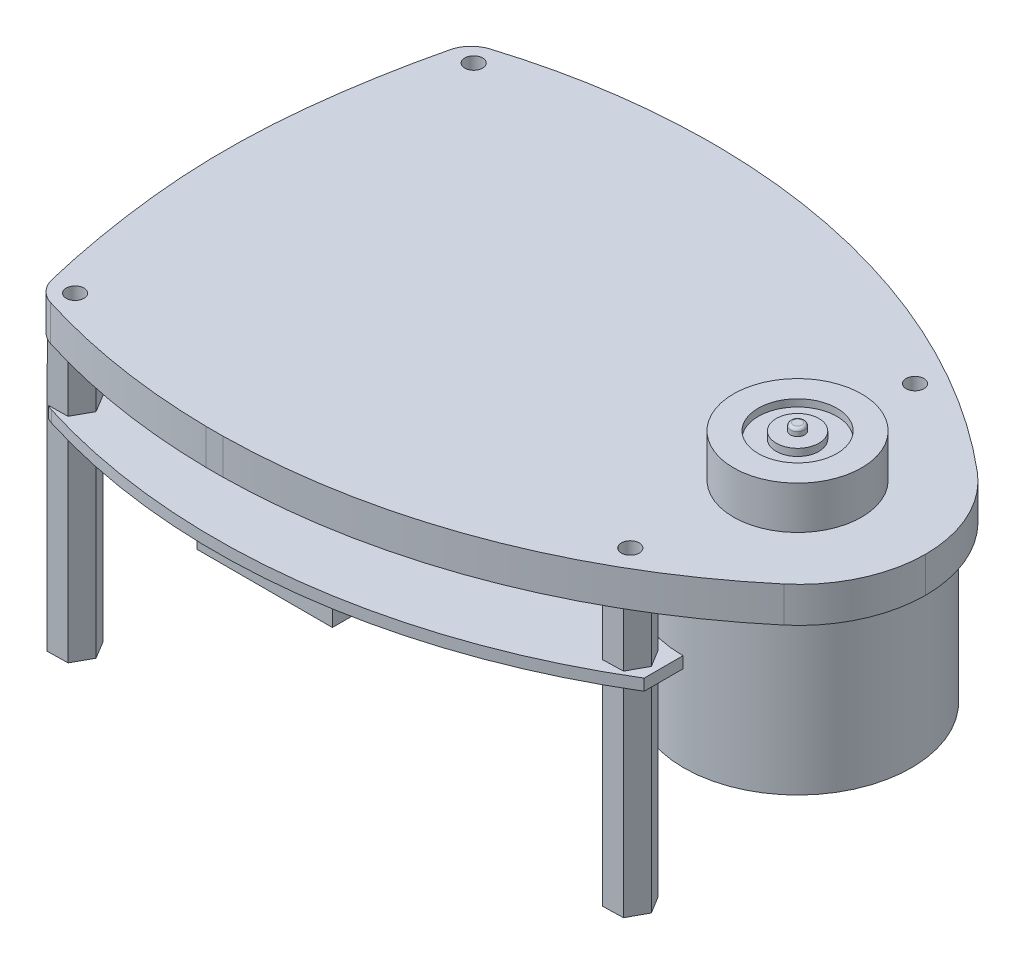
from build123d import *

# Parameters (mm, degrees)
SKETCH_1_W          = 98.5
SKETCH_1_H          = 70
EXTRUDE_1_DEPTH     = 5
SKETCH_2_R          = 35
EXTRUDE_2_DEPTH     = 28.1
SKETCH_3_R          = 2
CUT_EXTRUDE_1_DEPTH = 5
FILLET_1_R          = 2
FILLET_2_R          = 1
SKETCH_4_R          = 13
SKETCH_4_W          = 3.316540618
SKETCH_4_H          = 5.120069114
SKETCH_4_W_2        = 3.276095001
SKETCH_4_W_3        = 1.001370982
SKETCH_4_H_2        = 2.121481923
SKETCH_4_H_3        = 2.893302243
SKETCH_4_W_4        = 1.096399653
SKETCH_4_H_4        = 2.99297568
SKETCH_4_W_5        = 1.536933457
SKETCH_4_H_5        = 3.356986235
SKETCH_4_W_6        = 1.658270309
SKETCH_4_W_7        = 1.334705371
SKETCH_4_H_6        = 1.05158605
SKETCH_4_W_8        = 1.294259754
SKETCH_4_H_7        = 1.092031667
CUT_EXTRUDE_3_DEPTH = 0.5
SKETCH_5_R          = 1.25
CUT_EXTRUDE_4_DEPTH = 5
SKETCH_6_R          = 9
EXTRUDE_3_DEPTH     = 7
CUT_EXTRUDE_START   = -1
SKETCH_7_R          = 9
SKETCH_7_R_2        = 0.99350654
CUT_EXTRUDE_5_DEPTH = 1
SKETCH_8_R          = 5.521677929
SKETCH_8_R_2        = 3.001097475
CUT_EXTRUDE_6_DEPTH = 1
FILLET_3_R          = 0.4
SKETCH_9_R          = 16
EXTRUDE_4_DEPTH     = 27
EXTRUDE_5_DEPTH     = 38
SKETCH_11_R         = 26
EXTRUDE_6_DEPTH     = 8
FILLET_4_R          = 1
SKETCH_12_W         = 106.251501727
SKETCH_12_H         = 75.565901032
CUT_EXTRUDE_7_DEPTH = 8
FILLET_5_R          = 100
EXTRUDE_START       = 8
EXTRUDE_7_DEPTH     = 1.6
SKETCH_14_W         = 20
SKETCH_14_H         = 5
EXTRUDE_8_DEPTH     = 6
CHAMFER_1_SIZE      = 1
CUT_EXTRUDE1_START  = -28.1
SKETCH1_R           = 35
CUT_EXTRUDE1_DEPTH  = 28.1


with BuildPart() as part:
    # Эскиз1 → Бобышка-Вытянуть1 (new body)
    with BuildSketch(Plane(origin=(0, 0, 0), x_dir=(1, 0, 0), z_dir=(0, 1, 0))):
        Rectangle(SKETCH_1_W, SKETCH_1_H)
    extrude(amount=EXTRUDE_1_DEPTH)

    # Эскиз2 → Бобышка-Вытянуть2 (add)
    with BuildSketch(Plane(origin=(0, 5, 0), x_dir=(1, 0, 0), z_dir=(0, 1, 0))):
        with Locations(Location((-14.25, 0, 0), (0, 0, 270))):
            Circle(SKETCH_2_R)
    extrude(amount=EXTRUDE_2_DEPTH)

    # Эскиз3 → Вырез-Вытянуть1 (cut)
    with BuildSketch(Plane(origin=(0, 33.1, 0), x_dir=(1, 0, 0), z_dir=(0, 1, 0))):
        with Locations(Location((-14.25, 28.5, 0), (0, 0, 270))):
            Circle(SKETCH_3_R)
        with Locations(Location((-34.553940504, -20, 0), (0, 0, 270))):
            Circle(SKETCH_3_R)
        with Locations(Location((6.053940504, -20, 0), (0, 0, 270))):
            Circle(SKETCH_3_R)
    extrude(amount=-CUT_EXTRUDE_1_DEPTH, mode=Mode.SUBTRACT)

    # Скругление1
    fillet_1_edges = [part.edges().sort_by_distance(p)[0] for p in [
        (-14.25, 33.1, -35),
    ]]
    fillet(fillet_1_edges, radius=FILLET_1_R)

    # Скругление2
    fillet_2_edges = [part.edges().sort_by_distance(p)[0] for p in [
        (-14.25, 33.1, -30.5),
        (-34.553940504, 33.1, 18),
        (6.053940504, 33.1, 18),
    ]]
    fillet(fillet_2_edges, radius=FILLET_2_R)

    # Эскиз4 → Вырез-Вытянуть3 (cut)
    # profile 1 of 7: a face of its own
    with BuildSketch(Plane(origin=(0, 33.1, 0), x_dir=(1, 0, 0), z_dir=(0, 1, 0))):
        with Locations(Location((-14.25, 0, 0), (0, 0, 270))):
            Circle(SKETCH_4_R)
        Polygon((-22.115166942, -6.914876839), (-22.115166942, -0.831627154), (-19.0735421, -0.831627154), (-19.0735421, -5.853844917), (-21.266341405, -5.853844917), (-21.266341405, -6.914876839), align=None, mode=Mode.SUBTRACT)
        Polygon((-22.115166942, 0), (-22.115166942, 5.120069114), (-19.0735421, 5.120069114), (-19.0735421, 4.27071115), (-21.266341405, 4.27071115), (-21.266341405, 0), align=None, mode=Mode.SUBTRACT)
        Polygon((-13.829606569, 0), (-13.829606569, 6.292992015), (-12.980248606, 6.292992015), (-12.980248606, 5.120069114), (-10.715294037, 5.120069114), (-10.715294037, 0), align=None, mode=Mode.SUBTRACT)
        with Locations((-16.458571693, 2.560034557)):
            Rectangle(SKETCH_4_W, SKETCH_4_H, mode=Mode.SUBTRACT)
        with Locations((-8.187442955, 2.560034557)):
            Rectangle(SKETCH_4_W_2, SKETCH_4_H, mode=Mode.SUBTRACT)
        with Locations((-7.050080946, -1.825090787)):
            Rectangle(SKETCH_4_W_3, SKETCH_4_H_2, mode=Mode.SUBTRACT)
        with Locations((-7.050080946, -5.468225718)):
            Rectangle(SKETCH_4_W_3, SKETCH_4_H_3, mode=Mode.SUBTRACT)
        Polygon((-9.825490456, -0.831627154), (-8.643651064, -0.831627154), (-8.643651064, -2.960833634), (-7.550766437, -2.960833634), (-7.550766437, -3.957287265), (-8.643651064, -3.957287265), (-8.643651064, -5.853844917), (-9.825490456, -5.853844917), align=None, mode=Mode.SUBTRACT)
        Polygon((-13.829606569, -0.831627154), (-10.715294037, -0.831627154), (-10.715294037, -5.853844917), (-13.829606569, -5.853844917), (-13.829606569, -3.04994558), (-11.645543235, -3.04994558), (-11.645543235, -1.940786367), (-13.829606569, -1.940786367), align=None, mode=Mode.SUBTRACT)
        Polygon((-18.116842002, -0.831627154), (-14.800301384, -0.831627154), (-14.800301384, -4.141977247), (-16.943919101, -4.141977247), (-16.943919101, -4.950889593), (-14.800301384, -4.950889593), (-14.800301384, -5.853844917), (-18.116842002, -5.853844917), align=None, mode=Mode.SUBTRACT)
    # profile 2 of 7: a face of its own
    with BuildSketch(Plane(origin=(0, 33.1, 0), x_dir=(1, 0, 0), z_dir=(0, 1, 0))):
        with Locations((-20.718141579, -3.454401753)):
            Rectangle(SKETCH_4_W_4, SKETCH_4_H_4)
    # profile 3 of 7: a face of its own
    with BuildSketch(Plane(origin=(0, 33.1, 0), x_dir=(1, 0, 0), z_dir=(0, 1, 0))):
        with Locations((-8.167220148, 2.592218033)):
            Rectangle(SKETCH_4_W_5, SKETCH_4_H_5)
    # profile 4 of 7: a face of its own
    with BuildSketch(Plane(origin=(0, 33.1, 0), x_dir=(1, 0, 0), z_dir=(0, 1, 0))):
        with Locations((-16.478794502, 2.592218033)):
            Rectangle(SKETCH_4_W_6, SKETCH_4_H_5)
    # profile 5 of 7: a face of its own
    with BuildSketch(Plane(origin=(0, 33.1, 0), x_dir=(1, 0, 0), z_dir=(0, 1, 0))):
        with Locations((-12.312895921, 2.592218033)):
            Rectangle(SKETCH_4_W_7, SKETCH_4_H_5)
    # profile 6 of 7: a face of its own
    with BuildSketch(Plane(origin=(0, 33.1, 0), x_dir=(1, 0, 0), z_dir=(0, 1, 0))):
        with Locations((-12.312895921, -4.667770272)):
            Rectangle(SKETCH_4_W_7, SKETCH_4_H_6)
    # profile 7 of 7: a face of its own
    with BuildSketch(Plane(origin=(0, 33.1, 0), x_dir=(1, 0, 0), z_dir=(0, 1, 0))):
        with Locations((-16.296789224, -2.503929746)):
            Rectangle(SKETCH_4_W_8, SKETCH_4_H_7)
    extrude(amount=-CUT_EXTRUDE_3_DEPTH, mode=Mode.SUBTRACT)

    # Эскиз5 → Вырез-Вытянуть4 (cut)
    with BuildSketch(Plane(origin=(0, 5, 0), x_dir=(1, 0, 0), z_dir=(0, 1, 0))):
        with Locations(Location((-42.25, 28, 0), (0, 0, 270))):
            Circle(SKETCH_5_R)
        with Locations(Location((27.75, 20, 0), (0, 0, 270))):
            Circle(SKETCH_5_R)
        with Locations(Location((27.75, -20, 0), (0, 0, 90))):
            Circle(SKETCH_5_R)
        with Locations(Location((-42.25, -28, 0), (0, 0, 90))):
            Circle(SKETCH_5_R)
    extrude(amount=-CUT_EXTRUDE_4_DEPTH, mode=Mode.SUBTRACT)

    # Эскиз6 → Бобышка-Вытянуть3 (add)
    with BuildSketch(Plane(origin=(0, 5, 0), x_dir=(1, 0, 0), z_dir=(0, 1, 0))):
        with Locations(Location((31.25, 0, 0), (0, 0, 270))):
            Circle(SKETCH_6_R)
    extrude(amount=EXTRUDE_3_DEPTH)

    # Эскиз7 → Вырез-Вытянуть5 (cut)
    with BuildSketch(Plane(origin=(0, 12, 0), x_dir=(1, 0, 0), z_dir=(0, 1, 0)).offset(CUT_EXTRUDE_START)):
        with Locations(Location((31.25, 0, 0), (0, 0, 270))):
            Circle(SKETCH_7_R)
        with Locations(Location((31.25, 0, 0), (0, 0, 270))):
            Circle(SKETCH_7_R_2, mode=Mode.SUBTRACT)
    extrude(amount=CUT_EXTRUDE_5_DEPTH, mode=Mode.SUBTRACT)

    # Эскиз8 → Вырез-Вытянуть6 (cut)
    with BuildSketch(Plane(origin=(0, 11, 0), x_dir=(1, 0, 0), z_dir=(0, 1, 0))):
        with Locations(Location((31.25, 0, 0), (0, 0, 270))):
            Circle(SKETCH_8_R)
        with Locations(Location((31.25, 0, 0), (0, 0, 270))):
            Circle(SKETCH_8_R_2, mode=Mode.SUBTRACT)
    extrude(amount=-CUT_EXTRUDE_6_DEPTH, mode=Mode.SUBTRACT)

    # Скругление3
    fillet_3_edges = [part.edges().sort_by_distance(p)[0] for p in [
        (31.25, 12, -0.99350654),
    ]]
    fillet(fillet_3_edges, radius=FILLET_3_R)

    # Эскиз9 → Бобышка-Вытянуть4 (add)
    with BuildSketch(Plane(origin=(0, 5, 0), x_dir=(1, 0, 0), z_dir=(0, 1, 0))):
        with Locations(Location((31.25, 0, 0), (0, 0, 270))):
            Circle(SKETCH_9_R)
    extrude(amount=-EXTRUDE_4_DEPTH)

    # Эскиз10 → Бобышка-Вытянуть5 (add)
    with BuildSketch(Plane.XZ):
        Polygon((-40.854614908, 25.472900125), (-39.363774764, 27.944889), (-40.759159856, 30.471988875), (-43.645385092, 30.527099875), (-45.136225236, 28.055111), (-43.740840144, 25.528011125), align=None)
        Polygon((29.257133708, 22.462088812), (26.371335397, 22.536260484), (24.864201688, 20.074171672), (26.242866292, 17.537911188), (29.128664603, 17.463739516), (30.635798312, 19.925828328), align=None)
        Polygon((30.635798312, -19.925828328), (29.257133708, -22.462088812), (26.371335397, -22.536260484), (24.864201688, -20.074171672), (26.242866292, -17.537911188), (29.128664603, -17.463739516), align=None)
        Polygon((-43.740840144, -25.528011125), (-40.854614908, -25.472900125), (-39.363774764, -27.944889), (-40.759159856, -30.471988875), (-43.645385092, -30.527099875), (-45.136225236, -28.055111), align=None)
    extrude(amount=EXTRUDE_5_DEPTH)

    # Эскиз11 → Бобышка-Вытянуть6 (add)
    with BuildSketch(Plane(origin=(0, 5, 0), x_dir=(1, 0, 0), z_dir=(0, 1, 0))):
        with Locations(Location((-14.25, 0, 0), (0, 0, 270))):
            Circle(SKETCH_11_R)
    extrude(amount=-EXTRUDE_6_DEPTH)

    # Скругление4
    fillet_4_edges = [part.edges().sort_by_distance(p)[0] for p in [
        (-14.25, -3, -26),
    ]]
    fillet(fillet_4_edges, radius=FILLET_4_R)

    # Эскиз12 → Вырез-Вытянуть7 (cut)
    with BuildSketch(Plane(origin=(0, 5, 0), x_dir=(1, 0, 0), z_dir=(0, 1, 0))):
        with Locations((-0.925367694, -0.052186396)):
            Rectangle(SKETCH_12_W, SKETCH_12_H)
        with BuildLine():
            ThreePointArc((-49.25, 0), (-48.116981176, 14.083966884), (-45.528607092, 27.974329531))
            ThreePointArc((-45.528607092, 27.974329531), (-44.561596332, 29.769996926), (-42.834972324, 30.855492545))
            ThreePointArc((-42.834972324, 30.855492545), (2.249574036, 33.221442581), (42.908955543, 13.599293477))
            ThreePointArc((42.908955543, 13.599293477), (47.577997957, 7.498372972), (49.25, 0))
            ThreePointArc((49.25, 0), (47.577997957, -7.498372972), (42.908955543, -13.599293477))
            ThreePointArc((42.908955543, -13.599293477), (2.249574036, -33.221442581), (-42.834972324, -30.855492545))
            ThreePointArc((-42.834972324, -30.855492545), (-44.561596332, -29.769996926), (-45.528607092, -27.974329531))
            ThreePointArc((-45.528607092, -27.974329531), (-48.116981176, -14.083966884), (-49.25, 0))
        make_face(mode=Mode.SUBTRACT)
    extrude(amount=-CUT_EXTRUDE_7_DEPTH, mode=Mode.SUBTRACT)

    # Скругление5
    # the kernel refuses this fillet: 100 mm, written as the material it takes off along each edge
    with BuildSketch(Plane(origin=(-49.25, 5, 0), x_dir=(0.06766370453174418, 0, 0.9977081853372963), z_dir=(0, -1, 0))) as fillet_5_piece_1:
        with BuildLine():
            CenterArc((6.776645039, -99.922318338), FILLET_5_R, 87.741474483, 12.276669201)
            ThreePointArc((-10.619357471, -1.44704684), (-5.323940761, -0.618859533), (0, 0))
            ThreePointArc((0, 0), (5.358747467, 0.105631125), (10.717494933, 0))
        make_face()
    extrude(amount=31.793737334, mode=Mode.SUBTRACT)

    # Эскиз13 → Бобышка-Вытянуть7 (add)
    with BuildSketch(Plane.XZ.offset(EXTRUDE_START)):
        with BuildLine():
            Line((31.553634402, 21.860321538), (31.553634402, 16.4))
            ThreePointArc((31.553634402, 16.4), (15.153634402, 0), (31.553634402, -16.4))
            Line((31.553634402, -16.4), (31.553634402, -21.860321538))
            ThreePointArc((31.553634402, -21.860321538), (-4.596615235, -34.347840749), (-42.683124513, -30.855492545))
            ThreePointArc((-42.683124513, -30.855492545), (-44.409748521, -29.769996926), (-45.37675928, -27.974329531))
            ThreePointArc((-45.37675928, -27.974329531), (-47.965133365, -14.083966884), (-49.098152188, 0))
            ThreePointArc((-49.098152188, 0), (-47.965133365, 14.083966884), (-45.37675928, 27.974329531))
            ThreePointArc((-45.37675928, 27.974329531), (-44.409748521, 29.769996926), (-42.683124513, 30.855492545))
            ThreePointArc((-42.683124513, 30.855492545), (-4.596615235, 34.347840749), (31.553634402, 21.860321538))
        make_face()
    extrude(amount=EXTRUDE_7_DEPTH)

    # Эскиз14 → Бобышка-Вытянуть8 (add)
    with BuildSketch(Plane.XZ.offset(9.6)):
        with Locations((-14.098152188, 27.5)):
            Rectangle(SKETCH_14_W, SKETCH_14_H)
    extrude(amount=EXTRUDE_8_DEPTH)

    # Фаска1
    chamfer_1_edges = [part.edges().sort_by_distance(p)[0] for p in [
        (-24.098152188, -12.6, 30),
    ]]
    chamfer(chamfer_1_edges, length=CHAMFER_1_SIZE)

    # Sketch1 → Cut-Extrude1 (cut)
    with BuildSketch(Plane(origin=(0, 33.1, 0), x_dir=(1, 0, 0), z_dir=(0, 1, 0)).offset(CUT_EXTRUDE1_START)):
        with Locations((-14.25, 0)):
            Circle(SKETCH1_R)
    extrude(amount=CUT_EXTRUDE1_DEPTH, mode=Mode.SUBTRACT)


solid = part.part
